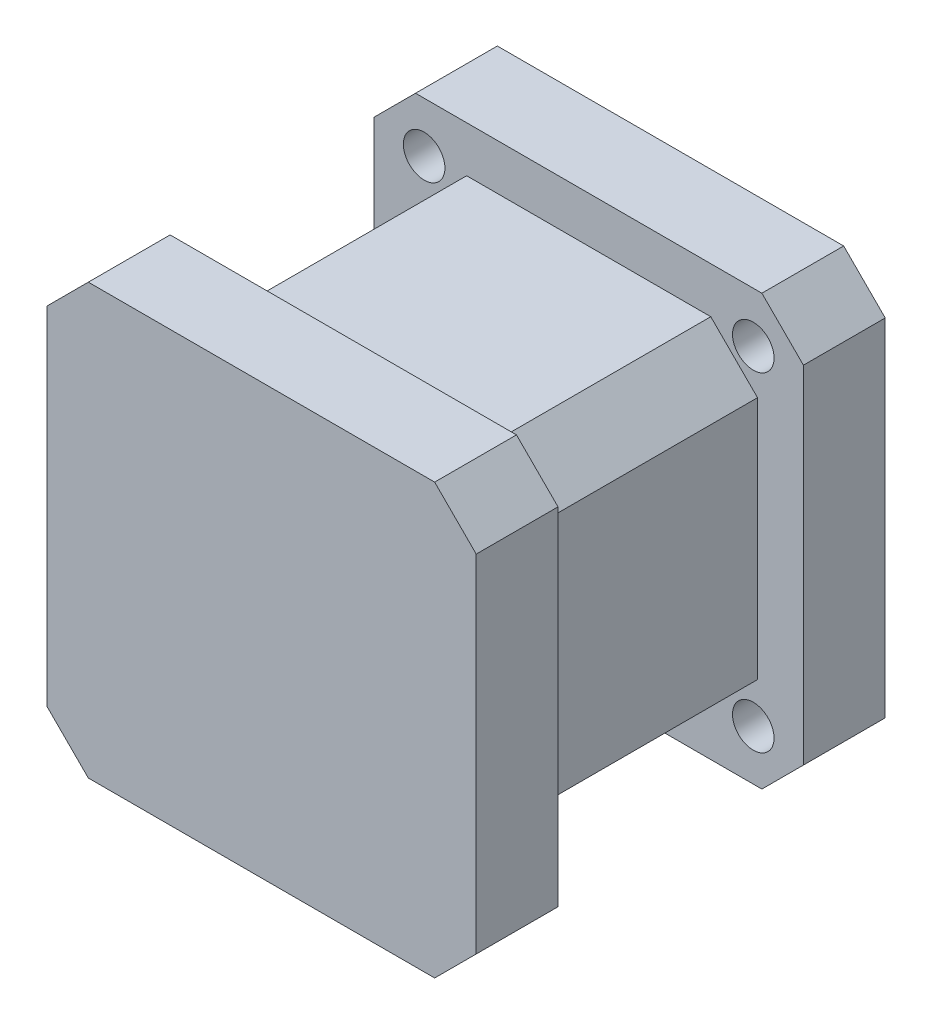
from build123d import *

# Parameters (mm, degrees)
BOSS_EXTRUDE1_DEPTH = 8
SKETCH2_R           = 2.032
CUT_EXTRUDE1_DEPTH  = 14.144
BOSS_EXTRUDE2_DEPTH = 24
BOSS_EXTRUDE3_DEPTH = 8
BOSS_EXTRUDE4_DEPTH = 1.27
CUT_EXTRUDE2_DEPTH  = 1.27
MIRROR2_DEPTH       = 40
MIRROR2_START       = 32
MIRROR2_2_DEPTH     = 8
MIRROR2_3_OUTLINE_R = 2.032
MIRROR2_3_DEPTH     = 8
MIRROR2_START_2     = -1.27
MIRROR2_4_DEPTH     = 1.27


# Read off the part's stored shape, not the designer's step: Mirror2
with BuildPart() as part:
    # Sketch1 → Boss-Extrude1 (new body)
    with BuildSketch(Plane.XY):
        Polygon((-21, 16.936), (-21, 0), (0, 0), (0, 21), (-16.936, 21), align=None)
    boss_extrude1 = extrude(amount=BOSS_EXTRUDE1_DEPTH)

    # Sketch2 → Cut-Extrude1 (cut)
    with BuildSketch(Plane.XY.offset(8)):
        with Locations((-16.094318041, 16.094318041)):
            Circle(SKETCH2_R)
    cut_extrude1 = extrude(amount=-CUT_EXTRUDE1_DEPTH, mode=Mode.SUBTRACT)

    # Sketch4 → Boss-Extrude2 (add)
    with BuildSketch(Plane.XY.offset(8)):
        Polygon((0, 0), (-16.51, 0), (-16.51, 11.938), (-11.938, 16.51), (0, 16.51), align=None)
    boss_extrude2 = extrude(amount=BOSS_EXTRUDE2_DEPTH)

    # Sketch5 → Boss-Extrude3 (add)
    with BuildSketch(Plane.XY.offset(32)):
        Polygon((0, 0), (0, 21), (-16.936, 21), (-21, 16.936), (-21, 0), align=None)
    boss_extrude3 = extrude(amount=BOSS_EXTRUDE3_DEPTH)

    # Sketch6 → Boss-Extrude4 (add)
    with BuildSketch(Plane(origin=(0, 0, 0), x_dir=(-1, 0, 0), z_dir=(0, 0, -1))):
        with BuildLine():
            Line((0, 6.35), (0, 0))
            Line((0, 0), (6.35, 0))
            ThreePointArc((6.35, 0), (4.490128061, 4.490128061), (0, 6.35))
        make_face()
    boss_extrude4 = extrude(amount=BOSS_EXTRUDE4_DEPTH)

    # Sketch7 → Cut-Extrude2 (cut)
    with BuildSketch(Plane(origin=(0, 0, -1.27), x_dir=(-1, 0, 0), z_dir=(0, 0, -1))):
        with BuildLine():
            Line((0, 5.08), (0, 0))
            Line((0, 0), (5.08, 0))
            ThreePointArc((5.08, 0), (3.592102448, 3.592102448), (0, 5.08))
        make_face()
    cut_extrude2 = extrude(amount=-CUT_EXTRUDE2_DEPTH, mode=Mode.SUBTRACT)

    # Mirror1: Boss-Extrude1, Cut-Extrude1, Boss-Extrude2, Boss-Extrude3, Boss-Extrude4, Cut-Extrude2 across Right Plane
    add(boss_extrude1.mirror(Plane(origin=(0, 0, 0), x_dir=(0, 0, -1), z_dir=(1, 0, 0))))
    add(cut_extrude1.mirror(Plane(origin=(0, 0, 0), x_dir=(0, 0, -1), z_dir=(1, 0, 0))), mode=Mode.SUBTRACT)
    add(boss_extrude2.mirror(Plane(origin=(0, 0, 0), x_dir=(0, 0, -1), z_dir=(1, 0, 0))))
    add(boss_extrude3.mirror(Plane(origin=(0, 0, 0), x_dir=(0, 0, -1), z_dir=(1, 0, 0))))
    add(boss_extrude4.mirror(Plane(origin=(0, 0, 0), x_dir=(0, 0, -1), z_dir=(1, 0, 0))))
    add(cut_extrude2.mirror(Plane(origin=(0, 0, 0), x_dir=(0, 0, -1), z_dir=(1, 0, 0))), mode=Mode.SUBTRACT)

    # Mirror2 outline → Mirror2 (add)
    with BuildSketch(Plane.XY):
        Polygon((-16.51, 0), (-16.51, -11.938), (-11.938, -16.51), (11.938, -16.51), (16.51, -11.938), (16.51, 0), align=None)
    extrude(amount=MIRROR2_DEPTH)

    # Mirror2 2 outline → Mirror2 2 (add)
    with BuildSketch(Plane.XY.offset(MIRROR2_START)):
        Polygon((-21, 0), (-21, -16.936), (-16.936, -21), (16.936, -21), (21, -16.936), (21, 0), (16.51, 0), (16.51, -11.938), (11.938, -16.51), (-11.938, -16.51), (-16.51, -11.938), (-16.51, 0), align=None)
    extrude(amount=MIRROR2_2_DEPTH)

    # Mirror2 3 outline → Mirror2 3 (add)
    with BuildSketch(Plane.XY):
        Polygon((-21, 0), (-21, -16.936), (-16.936, -21), (16.936, -21), (21, -16.936), (21, 0), (16.51, 0), (16.51, -11.938), (11.938, -16.51), (-11.938, -16.51), (-16.51, -11.938), (-16.51, 0), align=None)
        with Locations((-16.094318041, -16.094318041)):
            Circle(MIRROR2_3_OUTLINE_R, mode=Mode.SUBTRACT)
        with Locations((16.094318041, -16.094318041)):
            Circle(MIRROR2_3_OUTLINE_R, mode=Mode.SUBTRACT)
    extrude(amount=MIRROR2_3_DEPTH)

    # Mirror2 4 outline → Mirror2 4 (add)
    with BuildSketch(Plane.XY.offset(MIRROR2_START_2)):
        with BuildLine():
            Line((-5.08, 0), (-6.35, 0))
            ThreePointArc((-6.35, 0), (0, -6.35), (6.35, 0))
            Line((6.35, 0), (5.08, 0))
            ThreePointArc((5.08, 0), (0, -5.08), (-5.08, 0))
        make_face()
    extrude(amount=MIRROR2_4_DEPTH)


solid = part.part
